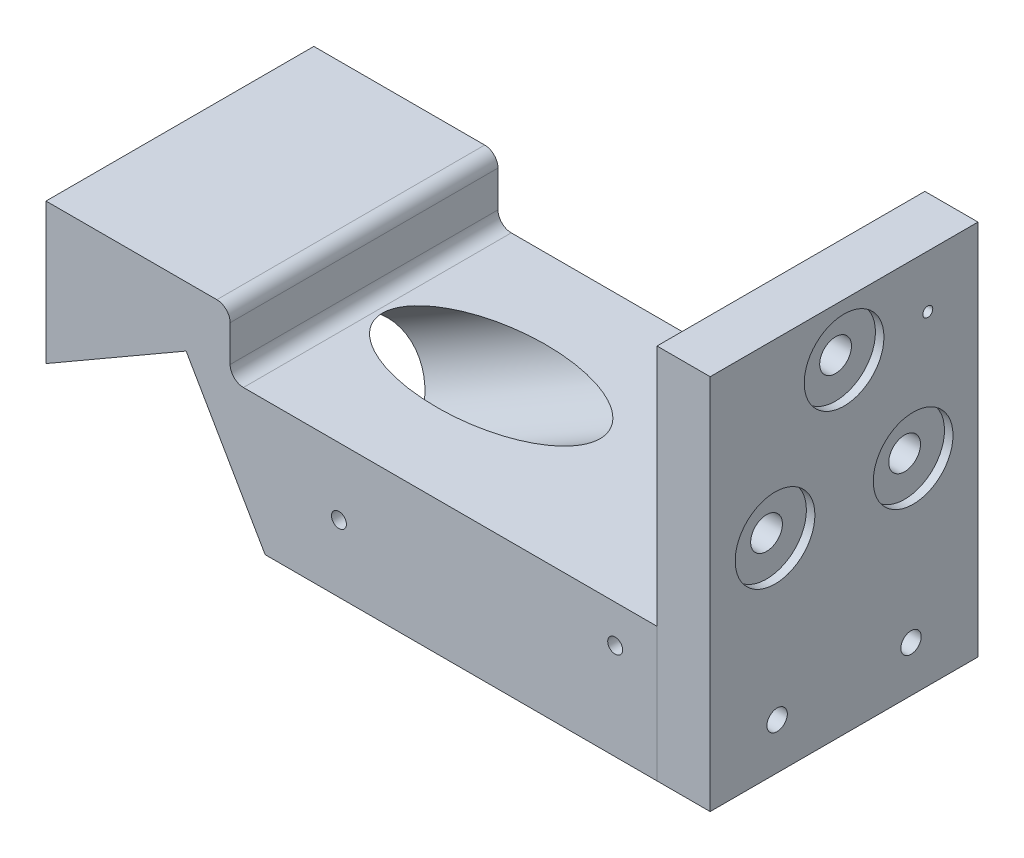
from build123d import *

# Parameters (mm, degrees)
SKETCH1_W                                           = 73
SKETCH1_H                                           = 32
BOSS_EXTRUDE1_DEPTH                                 = 16
BOSS_EXTRUDE4_DEPTH                                 = 32
CUT_EXTRUDE23_DEPTH                                 = 41
SKETCH26_W                                          = 6.35
SKETCH26_H                                          = 32
BOSS_EXTRUDE2_DEPTH                                 = 45
CUT_EXTRUDE2_DEPTH                                  = 41
CUT_EXTRUDE2_DEPTH_BACK                             = 33
SKETCH14_R                                          = 6.5
CUT_EXTRUDE7_REACH                                  = 94.614
SKETCH27_R                                          = 1.595
F_2_56_TAPPED_HOLE1_D                               = 1.778
F_2_56_TAPPED_HOLE1_DEPTH                           = 6.35
F_2_56_TAPPED_HOLE1_TIP                             = 0.53416509
CBORE_FOR_6_BINDING_HEAD_MACHINE_SCREW1_D           = 3.7973
CBORE_FOR_6_BINDING_HEAD_MACHINE_SCREW1_DEPTH       = 46.5
CBORE_FOR_6_BINDING_HEAD_MACHINE_SCREW1_CBORE_D     = 9.525
CBORE_FOR_6_BINDING_HEAD_MACHINE_SCREW1_CBORE_DEPTH = 1.016
CBORE_FOR_6_BINDING_HEAD_MACHINE_SCREW1_TIP         = 1.140824014
F_2_56_TAPPED_HOLE2_D                               = 1.778
F_2_56_TAPPED_HOLE2_DEPTH                           = 6.35
F_2_56_TAPPED_HOLE2_TIP                             = 0.53416509
F_2_56_TAPPED_HOLE3_D                               = 1.778
F_2_56_TAPPED_HOLE3_DEPTH                           = 6.35
F_2_56_TAPPED_HOLE3_TIP                             = 0.53416509
F_2_56_TAPPED_HOLE4_D                               = 1.778
F_2_56_TAPPED_HOLE4_DEPTH                           = 6.35
F_2_56_TAPPED_HOLE4_TIP                             = 0.53416509
F_2_56_TAPPED_HOLE5_D                               = 1.778
F_2_56_TAPPED_HOLE5_DEPTH                           = 4.76
F_2_56_TAPPED_HOLE5_TIP                             = 0.53416509
F_0_80_TAPPED_HOLE1_D                               = 1.19126
F_2_CLEARANCE_HOLE1_AT_2_COUNT                      = 2
F_2_CLEARANCE_HOLE1_AT_2_PITCH                      = 16
F_2_56_TAPPED_HOLE7_AT_2_COUNT                      = 2
F_2_56_TAPPED_HOLE7_AT_2_PITCH                      = 16


# Read off the part's stored shape, not the designer's step: Split1
with BuildPart() as part:
    # Sketch1 → Boss-Extrude1 (new body)
    with BuildSketch(Plane(origin=(0, 0, 0), x_dir=(1, 0, 0), z_dir=(0, 1, 0))):
        Rectangle(SKETCH1_W, SKETCH1_H)
    extrude(amount=BOSS_EXTRUDE1_DEPTH)

    # Sketch78 → Boss-Extrude4 (add)
    with BuildSketch(Plane.XY.offset(16)):
        with BuildLine():
            Line((-14.5, 16), (-12.9125, 16))
            ThreePointArc((-12.9125, 16), (-14.035032015, 16.464967985), (-14.5, 17.5875))
            Line((-14.5, 17.5875), (-14.5, 21.9125))
            ThreePointArc((-14.5, 21.9125), (-14.964967985, 23.035032015), (-16.0875, 23.5))
            Line((-16.0875, 23.5), (-36.5, 23.5))
            Line((-36.5, 23.5), (-36.5, 16))
            Line((-36.5, 16), (-14.5, 16))
        make_face()
    extrude(amount=-BOSS_EXTRUDE4_DEPTH)

    # Sketch79 → Cut-Extrude23 (cut)
    with BuildSketch(Plane(origin=(0, 0, -16), x_dir=(-1, 0, 0), z_dir=(0, 0, -1))):
        Polygon((14.495082625, 7.2325), (19.757582625, 16.347417375), (36.5, 6.681178197), (36.5, 0), (10.319396803, 0), align=None)
    extrude(amount=-CUT_EXTRUDE23_DEPTH, mode=Mode.SUBTRACT)

    # Sketch26 → Boss-Extrude2 (add)
    with BuildSketch(Plane.XZ):
        with Locations((39.675, 0)):
            Rectangle(SKETCH26_W, SKETCH26_H)
    extrude(amount=-BOSS_EXTRUDE2_DEPTH)

    # Sketch14 → Cut-Extrude2 (cut, two sides: drawn at the far end of the back side and taken through both)
    with BuildSketch(Plane(origin=(-13.426065962, 5.380908825, -20), x_dir=(0, 0, 1), z_dir=(-0.8660254037844418, -0.4999999999999945, 0)).offset(-CUT_EXTRUDE2_DEPTH_BACK)):
        with Locations(Location((20, 2.138033327, 0), (0, 0, 90))):
            Circle(SKETCH14_R)
    extrude(amount=CUT_EXTRUDE2_DEPTH + CUT_EXTRUDE2_DEPTH_BACK, mode=Mode.SUBTRACT)

    # Sketch27 → Cut-Extrude7 (cut, up to next)
    with BuildSketch(Plane(origin=(42.85, 0, 0), x_dir=(0, 0, -1), z_dir=(1, 0, 0)), mode=Mode.PRIVATE) as cut_extrude7_sk1:
        with Locations((0, 38.725)):
            Circle(SKETCH27_R)
    cut_extrude7_tool1 = extrude(cut_extrude7_sk1.sketch, amount=-CUT_EXTRUDE7_REACH, mode=Mode.PRIVATE) & part.part
    # Sketch27 → Cut-Extrude7 (cut, up to next)
    with BuildSketch(Plane(origin=(42.85, 0, 0), x_dir=(0, 0, -1), z_dir=(1, 0, 0)), mode=Mode.PRIVATE) as cut_extrude7_sk2:
        with Locations((8.248891971, 24.4375)):
            Circle(SKETCH27_R)
    cut_extrude7_tool2 = extrude(cut_extrude7_sk2.sketch, amount=-CUT_EXTRUDE7_REACH, mode=Mode.PRIVATE) & part.part
    # Sketch27 → Cut-Extrude7 (cut, up to next)
    with BuildSketch(Plane(origin=(42.85, 0, 0), x_dir=(0, 0, -1), z_dir=(1, 0, 0)), mode=Mode.PRIVATE) as cut_extrude7_sk3:
        with Locations((-8.248891971, 24.4375)):
            Circle(SKETCH27_R)
    cut_extrude7_tool3 = extrude(cut_extrude7_sk3.sketch, amount=-CUT_EXTRUDE7_REACH, mode=Mode.PRIVATE) & part.part
    add(cut_extrude7_tool1.solids().sort_by_distance((42.85, 38.725, 0))[0], mode=Mode.SUBTRACT)
    add(cut_extrude7_tool2.solids().sort_by_distance((42.85, 24.4375, -8.248892))[0], mode=Mode.SUBTRACT)
    add(cut_extrude7_tool3.solids().sort_by_distance((42.85, 24.4375, 8.248892))[0], mode=Mode.SUBTRACT)

    # #2-56 Tapped Hole1
    with Locations(Plane.ZY.offset(36.5)):
        with Locations((-10, 14.681178197), (10, 14.681178197)):
            Hole(F_2_56_TAPPED_HOLE1_D / 2, depth=F_2_56_TAPPED_HOLE1_DEPTH)
            with Locations((0, 0, -(F_2_56_TAPPED_HOLE1_DEPTH + F_2_56_TAPPED_HOLE1_TIP / 2))):  # 118° drill point
                Cone(0, F_2_56_TAPPED_HOLE1_D / 2, F_2_56_TAPPED_HOLE1_TIP, mode=Mode.SUBTRACT)

    # CBORE for #6 Binding Head Machine Screw1
    with Locations(Plane(origin=(42.85, 0, 0), x_dir=(0, 0, -1), z_dir=(1, 0, 0))):
        with Locations((0, 38.725), (8.248891971, 24.4375), (-8.248891971, 24.4375)):
            CounterBoreHole(CBORE_FOR_6_BINDING_HEAD_MACHINE_SCREW1_D / 2, CBORE_FOR_6_BINDING_HEAD_MACHINE_SCREW1_CBORE_D / 2, CBORE_FOR_6_BINDING_HEAD_MACHINE_SCREW1_CBORE_DEPTH, depth=CBORE_FOR_6_BINDING_HEAD_MACHINE_SCREW1_DEPTH)
            with Locations((0, 0, -(CBORE_FOR_6_BINDING_HEAD_MACHINE_SCREW1_DEPTH + CBORE_FOR_6_BINDING_HEAD_MACHINE_SCREW1_TIP / 2))):  # 118° drill point
                Cone(0, CBORE_FOR_6_BINDING_HEAD_MACHINE_SCREW1_D / 2, CBORE_FOR_6_BINDING_HEAD_MACHINE_SCREW1_TIP, mode=Mode.SUBTRACT)

    # #2-56 Tapped Hole2
    with Locations(Plane(origin=(0, 0, -16), x_dir=(-1, 0, 0), z_dir=(0, 0, -1))):
        with Locations((-31.5, 11.5), (1.5, 8)):
            Hole(F_2_56_TAPPED_HOLE2_D / 2, depth=F_2_56_TAPPED_HOLE2_DEPTH)
            with Locations((0, 0, -(F_2_56_TAPPED_HOLE2_DEPTH + F_2_56_TAPPED_HOLE2_TIP / 2))):  # 118° drill point
                Cone(0, F_2_56_TAPPED_HOLE2_D / 2, F_2_56_TAPPED_HOLE2_TIP, mode=Mode.SUBTRACT)

    # #2-56 Tapped Hole3
    with Locations(Plane.XY.offset(16)):
        with Locations((-1.5, 8), (31.5, 11.5)):
            Hole(F_2_56_TAPPED_HOLE3_D / 2, depth=F_2_56_TAPPED_HOLE3_DEPTH)
            with Locations((0, 0, -(F_2_56_TAPPED_HOLE3_DEPTH + F_2_56_TAPPED_HOLE3_TIP / 2))):  # 118° drill point
                Cone(0, F_2_56_TAPPED_HOLE3_D / 2, F_2_56_TAPPED_HOLE3_TIP, mode=Mode.SUBTRACT)

    # #2-56 Tapped Hole4
    with Locations(Plane(origin=(-7.739547602, -4.468429892, 0), x_dir=(0, 0, 1), z_dir=(-0.8660254037844419, -0.49999999999999456, 0))):
        with Locations((-10, 13.511070046), (10, 13.511070046), (0, 13.511070046)):
            Hole(F_2_56_TAPPED_HOLE4_D / 2, depth=F_2_56_TAPPED_HOLE4_DEPTH)
            with Locations((0, 0, -(F_2_56_TAPPED_HOLE4_DEPTH + F_2_56_TAPPED_HOLE4_TIP / 2))):  # 118° drill point
                Cone(0, F_2_56_TAPPED_HOLE4_D / 2, F_2_56_TAPPED_HOLE4_TIP, mode=Mode.SUBTRACT)

    # #2-56 Tapped Hole5
    with Locations(Plane(origin=(0, 0, -16), x_dir=(-1, 0, 0), z_dir=(0, 0, -1))):
        with Locations((31.5, 19)):
            Hole(F_2_56_TAPPED_HOLE5_D / 2, depth=F_2_56_TAPPED_HOLE5_DEPTH)
            with Locations((0, 0, -(F_2_56_TAPPED_HOLE5_DEPTH + F_2_56_TAPPED_HOLE5_TIP / 2))):  # 118° drill point
                Cone(0, F_2_56_TAPPED_HOLE5_D / 2, F_2_56_TAPPED_HOLE5_TIP, mode=Mode.SUBTRACT)

    # #0-80 Tapped Hole1 (through all)
    with Locations(Plane(origin=(42.85, 0, 0), x_dir=(0, 0, -1), z_dir=(1, 0, 0))):
        with Locations((10, 38.725)):
            Hole(F_0_80_TAPPED_HOLE1_D / 2)


with BuildPart() as body_2:
    # Split1: the piece on the far side of the plane
    add(part.part)
    split(bisect_by=Plane.YZ.offset(36.5), keep=Keep.BOTTOM)

    # Sketch104 → #2-56 Tapped Hole7 (revolve, cut)
    with BuildSketch(Plane(origin=(36.5, 5.5, 8), x_dir=(0, 0, -1), z_dir=(0, 1, 0))):
        Polygon((0, 0), (0, 13.53416509), (0.889, 13), (0.889, 0), align=None)
    f_2_56_tapped_hole7 = revolve(axis=Axis((42.85, 5.5, 8), (-1, 0, 0)), mode=Mode.SUBTRACT)

    # #2-56 Tapped Hole7 at 2: #2-56 Tapped Hole7 ×2
    with Locations(*[(0, 0, -i * F_2_56_TAPPED_HOLE7_AT_2_PITCH) for i in range(1, F_2_56_TAPPED_HOLE7_AT_2_COUNT)]):
        add(f_2_56_tapped_hole7, mode=Mode.SUBTRACT)


with BuildPart() as part_1:
    add(part.part)

    # Split1
    split(bisect_by=Plane.YZ.offset(36.5), keep=Keep.TOP)

    # Sketch102 → #2 Clearance Hole1 (revolve, cut)
    with BuildSketch(Plane(origin=(42.85, 5.5, 8), x_dir=(0, 0, -1), z_dir=(0, 1, 0))):
        Polygon((0, 0), (0, 21.052569267), (1.2192, 20.32), (1.2192, 0), align=None)
    f_2_clearance_hole1 = revolve(axis=Axis((49.2, 5.5, 8), (-1, 0, 0)), mode=Mode.SUBTRACT)

    # #2 Clearance Hole1 at 2: #2 Clearance Hole1 ×2
    with Locations(*[(0, 0, -i * F_2_CLEARANCE_HOLE1_AT_2_PITCH) for i in range(1, F_2_CLEARANCE_HOLE1_AT_2_COUNT)]):
        add(f_2_clearance_hole1, mode=Mode.SUBTRACT)


solid = Compound([body_2.part, part_1.part])
